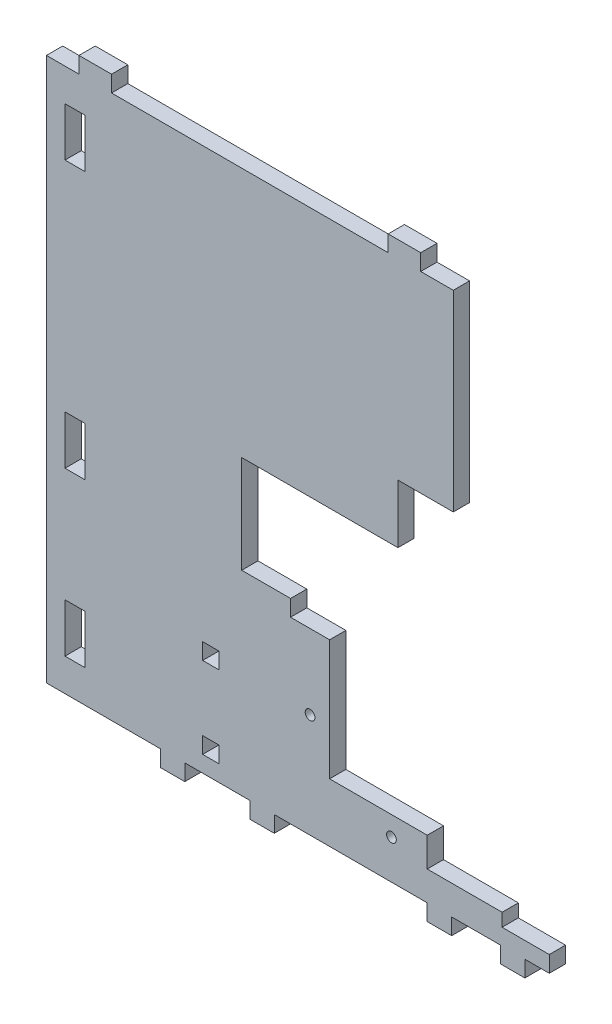
from build123d import *

# Parameters (mm, degrees)
ESQUISSE1_R        = 1.5
BOSS_EXTRU_1_DEPTH = 5
ESQUISSE2_W        = 6.138933528
ESQUISSE2_H        = 15
ESQUISSE2_W_2      = 5
ESQUISSE2_H_2      = 5
BOSS_EXTRU_2_DEPTH = 5


with BuildPart() as part:
    # Esquisse1 → Boss.-Extru.1 (new body)
    with BuildSketch(Plane.XY):
        Polygon((0, 0), (37, 0), (37, 18), (12, 18), (12, 55), (0, 55), align=None)
        with Locations((6, 32)):
            Circle(ESQUISSE1_R, mode=Mode.SUBTRACT)
        with Locations((31, 12)):
            Circle(ESQUISSE1_R, mode=Mode.SUBTRACT)
    extrude(amount=BOSS_EXTRU_1_DEPTH)

    # Esquisse2 → Boss.-Extru.2 (add)
    # profile 1 of 2: a face of its own
    with BuildSketch(Plane.XY.offset(5)):
        Polygon((37, 18), (37, 0), (42, 0), (42, -5), (49.5, -5), (49.5, 0), (64.5, 0), (64.5, -5), (72, -5), (72, 0), (79.5, 0), (79.5, 5), (65, 5), (65, 9), (42, 9), (42, 18), align=None)
    # profile 2 of 2: a face of its own
    with BuildSketch(Plane.XY.offset(5)):
        Polygon((-5, 0), (0, 0), (0, 60), (-15, 60), (-15, 90), (33, 90), (33, 108), (50, 108), (50, 167), (40, 167), (40, 172), (30, 172), (30, 167), (-55, 167), (-55, 172), (-65, 172), (-65, 167), (-75, 167), (-75, 0), (-40, 0), (-40, -5), (-32.5, -5), (-32.5, 0), (-12.5, 0), (-12.5, -5), (-5, -5), align=None)
        with Locations((-66.228617731, 17.5)):
            Rectangle(ESQUISSE2_W, ESQUISSE2_H, mode=Mode.SUBTRACT)
        with Locations((-24.5, 7.5)):
            Rectangle(ESQUISSE2_W_2, ESQUISSE2_H_2, mode=Mode.SUBTRACT)
        with Locations((-24.5, 32.5)):
            Rectangle(ESQUISSE2_W_2, ESQUISSE2_H_2, mode=Mode.SUBTRACT)
        with Locations((-66.228617731, 67.5)):
            Rectangle(ESQUISSE2_W, ESQUISSE2_H, mode=Mode.SUBTRACT)
        with Locations((-66.228617731, 149.5)):
            Rectangle(ESQUISSE2_W, ESQUISSE2_H, mode=Mode.SUBTRACT)
    extrude(amount=-BOSS_EXTRU_2_DEPTH)


solid = part.part
